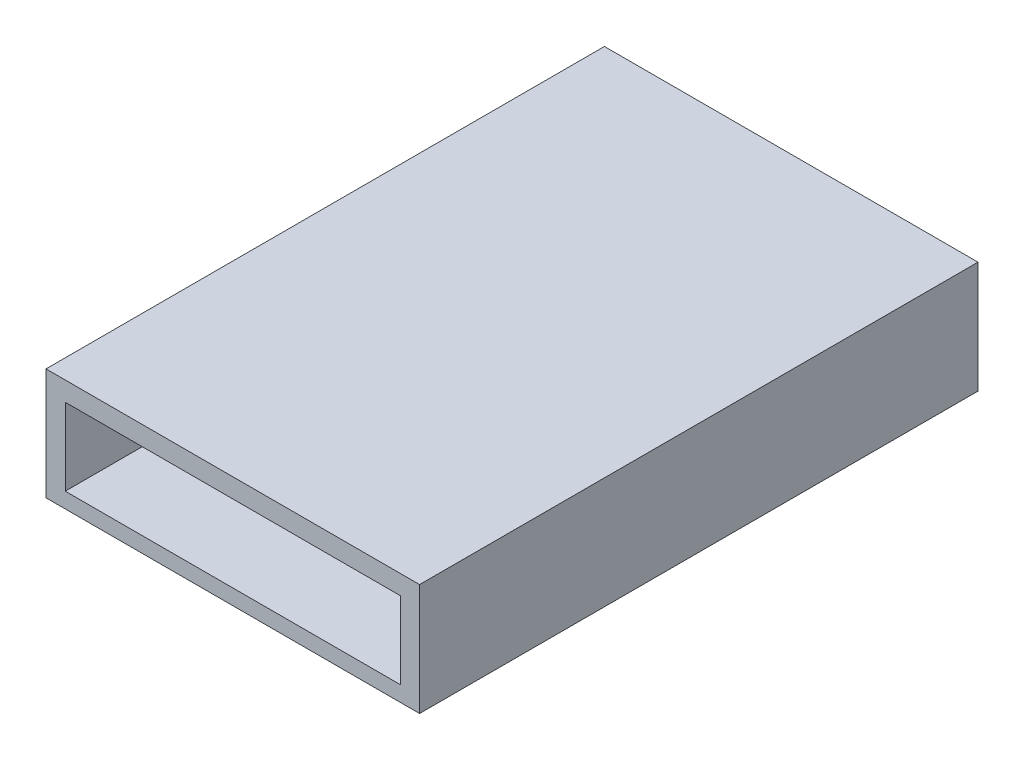
from build123d import *

# Parameters (mm, degrees)
SKETCH1_W           = 19.4
SKETCH1_H           = 5.8
BOSS_EXTRUDE1_DEPTH = 29
SKETCH2_W           = 17.4
SKETCH2_H           = 4
CUT_EXTRUDE1_DEPTH  = 28
SKETCH4_R           = 2.425
CUT_EXTRUDE3_DEPTH  = 0.8
CUT_EXTRUDE2_DEPTH  = 28


with BuildPart() as part:
    # Sketch1 → Boss-Extrude1 (new body)
    with BuildSketch(Plane.XY):
        with Locations((9.7, 2.9)):
            Rectangle(SKETCH1_W, SKETCH1_H)
    extrude(amount=BOSS_EXTRUDE1_DEPTH)

    # Sketch2 → Cut-Extrude1 (cut)
    with BuildSketch(Plane.XY.offset(29)):
        with Locations((9.7, 2.8)):
            Rectangle(SKETCH2_W, SKETCH2_H)
    extrude(amount=-CUT_EXTRUDE1_DEPTH, mode=Mode.SUBTRACT)

    # Sketch4 → Cut-Extrude3 (cut)
    with BuildSketch(Plane.XZ):
        with Locations((15.375, 22.765)):
            Circle(SKETCH4_R)
        with Locations((7.405, 6.825)):
            Circle(SKETCH4_R)
    extrude(amount=-CUT_EXTRUDE3_DEPTH, mode=Mode.SUBTRACT)

    # Sketch3 → Cut-Extrude2 (cut)
    with BuildSketch(Plane.XY.offset(1)):
        Polygon((5.7, 4.7), (13.7, 4.7), (13.7, 3.3), (12.5, 1.9), (6.9, 1.9), (5.7, 3.3), align=None)
    extrude(amount=-CUT_EXTRUDE2_DEPTH, mode=Mode.SUBTRACT)


solid = part.part
